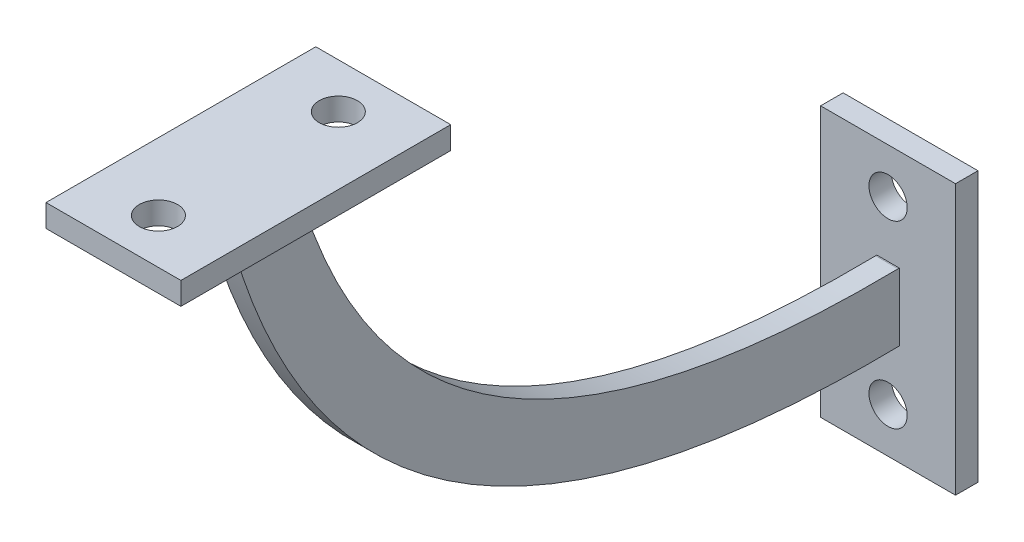
from build123d import *

# Parameters (mm, degrees)
BOSS_EXTRUDE3_DEPTH = 5
SKETCH5_W           = 30
SKETCH5_H           = 60
SKETCH5_R           = 4.25
BOSS_EXTRUDE7_DEPTH = 5
SKETCH6_W           = 30
SKETCH6_H           = 60
SKETCH6_R           = 4.25
BOSS_EXTRUDE8_DEPTH = 5


# Read off the part's stored shape, not the designer's step: Boss-Extrude3
with BuildPart() as part:
    # Boss-Extrude3 outline → Boss-Extrude3 (new body)
    with BuildSketch(Plane(origin=(0, 0, 0), x_dir=(0, 0, -1), z_dir=(1, 0, 0))):
        with BuildLine():
            Line((-134.507952774, 100), (-150, 100))
            add(Edge.make_bspline(
                [(-150, 100), (-124.823277558, -2.14164181), (0, 0)],
                knots=[0, 0, 0, 1, 1, 1], degree=2))
            Line((0, 0), (0, 15))
            Line((0, 15), (-0.257322997, 14.997792667))
            add(Edge.make_bspline(
                [(-0.257322997, 14.997792667), (-22.513069097, 14.639377531), (-53.120235991, 19.679743273), (-74.17523554, 26.538598941), (-91.96421888, 36.076540514), (-106.790873123, 48.266354422), (-118.971580699, 63.298366178), (-130.328132656, 84.632434891), (-134.507952774, 100)],
                knots=[0, 0, 0, 0.1875, 0.3125, 0.4375, 0.5625, 0.6875, 0.8125, 0.98060163, 0.98060163, 0.98060163], degree=2))
        make_face()
    extrude(amount=BOSS_EXTRUDE3_DEPTH)

    # Sketch5 → Boss-Extrude7 (add)
    with BuildSketch(Plane(origin=(0, 100, 0), x_dir=(1, 0, 0), z_dir=(0, 1, 0))):
        with Locations((2.5, -142.253976387)):
            Rectangle(SKETCH5_W, SKETCH5_H)
        with Locations(Location((2.5, -162.253976387, 0), (0, 0, 270))):
            Circle(SKETCH5_R, mode=Mode.SUBTRACT)
        with Locations(Location((2.5, -122.253976387, 0), (0, 0, 90))):
            Circle(SKETCH5_R, mode=Mode.SUBTRACT)
    extrude(amount=BOSS_EXTRUDE7_DEPTH)

    # Sketch6 → Boss-Extrude8 (add)
    with BuildSketch(Plane(origin=(0, 0, 0), x_dir=(-1, 0, 0), z_dir=(0, 0, -1))):
        with Locations((-2.5, 7.5)):
            Rectangle(SKETCH6_W, SKETCH6_H)
        with Locations(Location((-2.5, 27.5, 0), (0, 0, 90))):
            Circle(SKETCH6_R, mode=Mode.SUBTRACT)
        with Locations(Location((-2.5, -12.5, 0), (0, 0, 90))):
            Circle(SKETCH6_R, mode=Mode.SUBTRACT)
    extrude(amount=BOSS_EXTRUDE8_DEPTH)


solid = part.part
